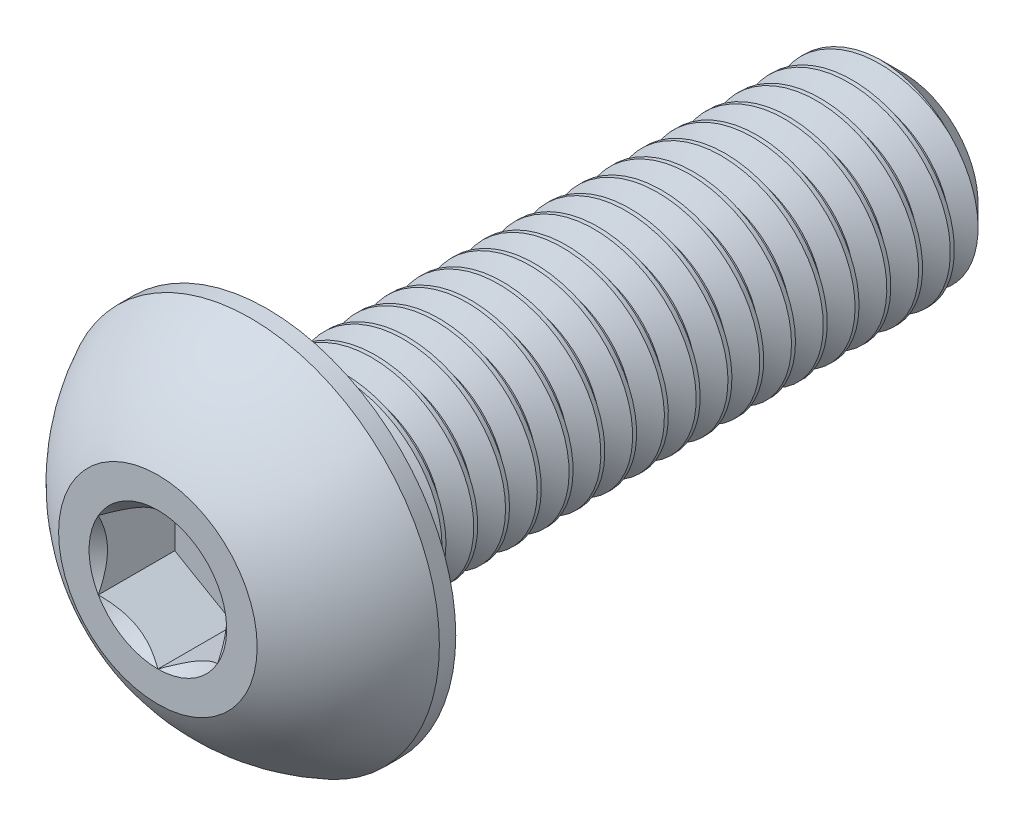
from build123d import *

# Parameters (mm, degrees)
SKETCH1_W          = 16
SKETCH1_H          = 2.5
CHAMFER1_SIZE      = 0.6
CUT_EXTRUDE2_DEPTH = 1.925
CUT_SWEEP1_PITCH   = 0.8


with BuildPart() as part:
    # Sketch1 → Revolve1 (revolve)
    with BuildSketch(Plane(origin=(0, 0, 0), x_dir=(0, 0, -1), z_dir=(1, 0, 0)), mode=Mode.PRIVATE) as revolve1_sk:
        with Locations((10.75, 1.25)):
            Rectangle(SKETCH1_W, SKETCH1_H)
    revolve(revolve1_sk.sketch.rotate(Axis((0, 0, -18.75), (0, 0, 1)), 90), axis=Axis((0, 0, -18.75), (0, 0, 1)))

    # Chamfer1
    chamfer1_edges = [part.edges().sort_by_distance(p)[0] for p in [
        (2.5, 0, -18.75),
    ]]
    chamfer(chamfer1_edges, length=CHAMFER1_SIZE)

    # Sketch7 → Revolve2 (revolve)
    with BuildSketch(Plane(origin=(0, 0, 0), x_dir=(0, 0, -1), z_dir=(1, 0, 0)), mode=Mode.PRIVATE) as revolve2_sk:
        with BuildLine():
            Line((2.3375, 4.75), (2.75, 4.75))
            Line((2.75, 4.75), (2.75, 0))
            Line((2.75, 0), (0, 0))
            Line((0, 0), (0, 2.5))
            ThreePointArc((0, 2.5), (0.991875183, 3.808753282), (2.3375, 4.75))
        make_face()
    revolve(revolve2_sk.sketch.rotate(Axis((0, 0, 0), (0, 0, -1)), 180), axis=Axis((0, 0, 0), (0, 0, -1)))

    # Sketch5 → Cut-Extrude2 (cut)
    with BuildSketch(Plane.XY):
        Polygon((1.5, -0.866025404), (1.5, 0.866025404), (0, 1.732050808), (-1.5, 0.866025404), (-1.5, -0.866025404), (0, -1.732050808), align=None)
    extrude(amount=-CUT_EXTRUDE2_DEPTH, mode=Mode.SUBTRACT)

    # Cut-Extrude3 cone 1 section (through the dimple's axis) → Cut-Extrude3 (revolve, cut)
    with BuildSketch(Plane(origin=(0, 0, 0), x_dir=(0, -1, 0), z_dir=(1, 0, 0))):
        Polygon((0, 0), (1.732050808, 0), (0, 1.732050808), align=None)
    revolve(axis=Axis((0, 0, 0), (0, 0, -1)), mode=Mode.SUBTRACT)

    # Cut-Sweep1: the profile of Sketch2 profile screwed along a right-hand helix of 21 turns, 8 arcs to a turn; built about Z, then put on its axis
    cut_sweep1_z = Axis((0, 0, 0), (0, 0, 1))
    cut_sweep1_corners = [(2.5003, 0, 0.600173205), (2.5003, 0, -0.100173205), (1.980384758, 0, 0.2), (1.980384758, 0, 0.3)]
    with BuildLine(mode=Mode.PRIVATE) as cut_sweep1_profile:
        Line(cut_sweep1_corners[0], cut_sweep1_corners[1])
        Line(cut_sweep1_corners[1], cut_sweep1_corners[2])
        Line(cut_sweep1_corners[2], cut_sweep1_corners[3])
        Line(cut_sweep1_corners[3], cut_sweep1_corners[0])
    cut_sweep1_cap = Face(cut_sweep1_profile.wire())
    cut_sweep1_turn_angles = [0, 22.5, 45, 67.5, 90, 112.5, 135, 157.5, 180, 202.5, 225, 247.5, 270, 292.5, 315, 337.5, 360]
    cut_sweep1_turn_weights = [1, 0.9238795325112867, 1, 0.9238795325112867, 1, 0.9238795325112867, 1, 0.9238795325112867, 1, 0.9238795325112867, 1, 0.9238795325112867, 1, 0.9238795325112867, 1, 0.9238795325112867, 1]
    cut_sweep1_turn_rails = [Edge.make_bspline([Vector(p[0], p[1], 0).rotate(cut_sweep1_z, cut_sweep1_turn_angles[k]) / cut_sweep1_turn_weights[k] + Vector(0, 0, p[2] + CUT_SWEEP1_PITCH * cut_sweep1_turn_angles[k] / 360) for k in range(17)], [0, 0, 0, 1, 1, 2, 2, 3, 3, 4, 4, 5, 5, 6, 6, 7, 7, 8, 8, 8], 2, cut_sweep1_turn_weights) for p in cut_sweep1_corners]
    cut_sweep1_turn_sides = [Face.make_surface_from_curves(cut_sweep1_turn_rails[p[0]], cut_sweep1_turn_rails[p[1]]) for p in [(0, 1), (1, 2), (2, 3), (3, 0)]]
    cut_sweep1 = Plane(origin=(0, 0, -18.75), x_dir=(0, 1, 0), z_dir=(0, 0, 1)) * Solid(Shell([*[p.moved(Location((0, 0, CUT_SWEEP1_PITCH * i))) for i in range(21) for p in cut_sweep1_turn_sides], cut_sweep1_cap, cut_sweep1_cap.rotate(cut_sweep1_z, 7560).moved(Location((0, 0, CUT_SWEEP1_PITCH * 7560 / 360)))]))
    add(cut_sweep1, mode=Mode.SUBTRACT)


solid = part.part
